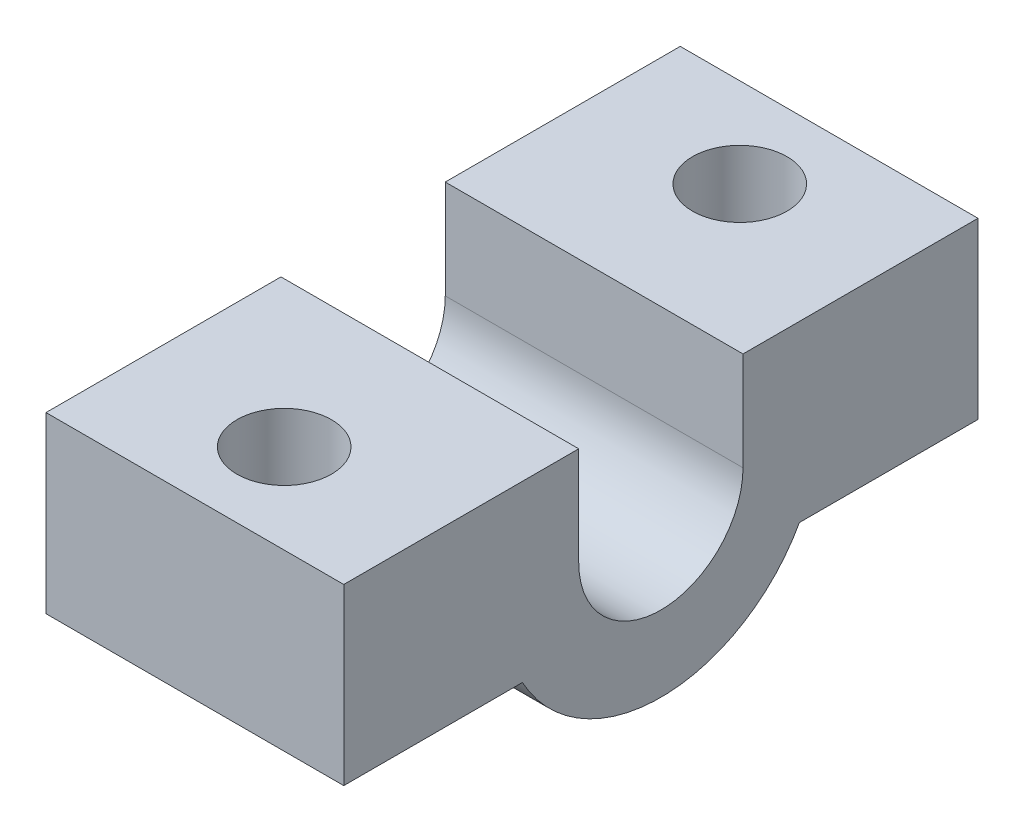
from build123d import *

# Parameters (mm, degrees)
BOSS_EXTRUDE1_DEPTH = 40
CUT_EXTRUDE1_REACH  = 69.83
SKETCH3_R           = 6.35


with BuildPart() as part:
    # Sketch2 → Boss-Extrude1 (new body)
    with BuildSketch(Plane(origin=(0, 0, 0), x_dir=(0, 0, -1), z_dir=(1, 0, 0))):
        with BuildLine():
            Line((-18.601140422, -10.16), (-42.601140422, -10.16))
            Line((-42.601140422, -10.16), (-42.601140422, 0))
            Line((-42.601140422, 0), (-42.601140422, 13.245))
            Line((-42.601140422, 13.245), (-11.035, 13.245))
            Line((-11.035, 13.245), (-11.035, 0))
            ThreePointArc((-11.035, 0), (0, -11.035), (11.035, 0))
            Line((11.035, 0), (11.035, 13.245))
            Line((11.035, 13.245), (42.601140422, 13.245))
            Line((42.601140422, 13.245), (42.601140422, -10.16))
            Line((42.601140422, -10.16), (18.601140422, -10.16))
            ThreePointArc((18.601140422, -10.16), (0, -21.195), (-18.601140422, -10.16))
        make_face()
    extrude(amount=BOSS_EXTRUDE1_DEPTH)

    # Sketch3 → Cut-Extrude1 (cut, up to next)
    with BuildSketch(Plane(origin=(0, 13.245, 0), x_dir=(1, 0, 0), z_dir=(0, 1, 0)), mode=Mode.PRIVATE) as cut_extrude1_sk1:
        with Locations((20, -30.601140422)):
            Circle(SKETCH3_R)
    cut_extrude1_tool1 = extrude(cut_extrude1_sk1.sketch, amount=-CUT_EXTRUDE1_REACH, mode=Mode.PRIVATE) & part.part
    # Sketch3 → Cut-Extrude1 (cut, up to next)
    with BuildSketch(Plane(origin=(0, 13.245, 0), x_dir=(1, 0, 0), z_dir=(0, 1, 0)), mode=Mode.PRIVATE) as cut_extrude1_sk2:
        with Locations((20, 30.598859578)):
            Circle(SKETCH3_R)
    cut_extrude1_tool2 = extrude(cut_extrude1_sk2.sketch, amount=-CUT_EXTRUDE1_REACH, mode=Mode.PRIVATE) & part.part
    add(cut_extrude1_tool1.solids().sort_by_distance((20, 13.245, 30.60114))[0], mode=Mode.SUBTRACT)
    add(cut_extrude1_tool2.solids().sort_by_distance((20, 13.245, -30.59886))[0], mode=Mode.SUBTRACT)


solid = part.part
